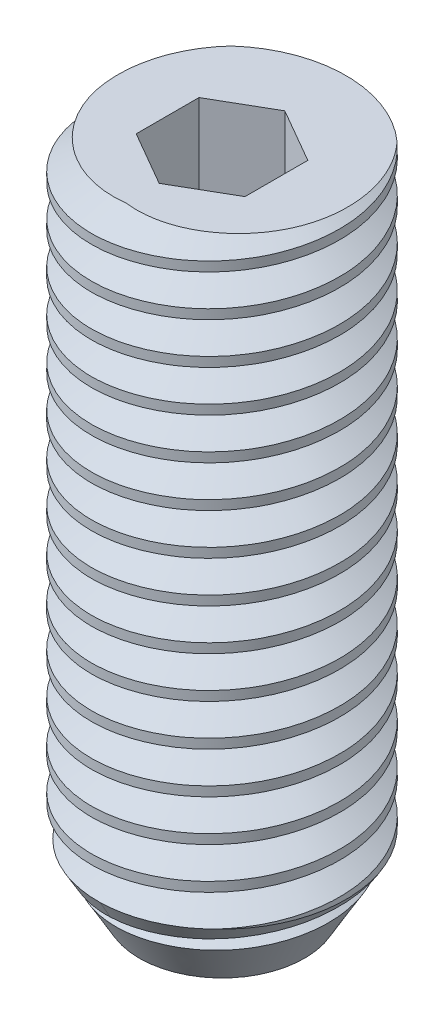
from build123d import *

# Parameters (mm, degrees)
SKETCH1_R           = 1.5
BOSS_EXTRUDE1_DEPTH = 8
CUT_EXTRUDE1_DEPTH  = 1.2
CHAMFER1_SIZE       = 0.5
CHAMFER1_SIZE2      = 0.866025404
CUT_SWEEP13_PITCH   = 0.5


with BuildPart() as part:
    # Sketch1 → Boss-Extrude1 (new body)
    with BuildSketch(Plane(origin=(0, 0, 0), x_dir=(1, 0, 0), z_dir=(0, 1, 0))):
        with Locations(Location((0, 0, 0), (0, 0, 270))):
            Circle(SKETCH1_R)
    extrude(amount=BOSS_EXTRUDE1_DEPTH)

    # Sketch2 → Cut-Extrude1 (cut)
    with BuildSketch(Plane(origin=(0, 8, 0), x_dir=(1, 0, 0), z_dir=(0, 1, 0))):
        Polygon((0, 0.76), (-0.658179307, 0.38), (-0.658179307, -0.38), (0, -0.76), (0.658179307, -0.38), (0.658179307, 0.38), align=None)
    extrude(amount=-CUT_EXTRUDE1_DEPTH, mode=Mode.SUBTRACT)

    # Chamfer1
    chamfer1_edges = [part.edges().sort_by_distance(p)[0] for p in [
        (0, 0, -1.5),
    ]]
    chamfer1_side = [part.faces().sort_by_distance(p)[0] for p in [
        (0, 0, 0),
    ]]
    chamfer(chamfer1_edges, length=CHAMFER1_SIZE, length2=CHAMFER1_SIZE2, reference=chamfer1_side[0])

    # Cut-Sweep13: arcs per turn and ends read off the stored shape
    # Cut-Sweep13: the profile of Sketch15 screwed along a right-hand helix through 17 turns, 6 arcs to a turn; built about Z, then put on its axis
    cut_sweep13_z = Axis((0, 0, 0), (0, 0, 1))
    cut_sweep13_corners = [(1.166666667, 2.04e-07, -0.374999986), (1.666666667, 2.91e-07, -0.663675121), (1.666666667, 2.91e-07, -0.086324852)]
    with BuildLine(mode=Mode.PRIVATE) as cut_sweep13_profile:
        Line(cut_sweep13_corners[0], cut_sweep13_corners[1])
        Line(cut_sweep13_corners[1], cut_sweep13_corners[2])
        Line(cut_sweep13_corners[2], cut_sweep13_corners[0])
    cut_sweep13_cap = Face(cut_sweep13_profile.wire())
    cut_sweep13_turn_angles = [0, 30, 60, 90, 120, 150, 180, 210, 240, 270, 300, 330, 360]
    cut_sweep13_turn_weights = [1, 0.8660254037844387, 1, 0.8660254037844387, 1, 0.8660254037844387, 1, 0.8660254037844387, 1, 0.8660254037844387, 1, 0.8660254037844387, 1]
    cut_sweep13_turn_rails = [Edge.make_bspline([Vector(p[0], p[1], 0).rotate(cut_sweep13_z, cut_sweep13_turn_angles[k]) / cut_sweep13_turn_weights[k] + Vector(0, 0, p[2] + CUT_SWEEP13_PITCH * cut_sweep13_turn_angles[k] / 360) for k in range(13)], [0, 0, 0, 1, 1, 2, 2, 3, 3, 4, 4, 5, 5, 6, 6, 6], 2, cut_sweep13_turn_weights) for p in cut_sweep13_corners]
    cut_sweep13_turn_sides = [Face.make_surface_from_curves(cut_sweep13_turn_rails[p[0]], cut_sweep13_turn_rails[p[1]]) for p in [(0, 1), (1, 2), (2, 0)]]
    cut_sweep13 = Plane(origin=(0, 8, 0), x_dir=(-1, 0, 0), z_dir=(0, -1, 0)) * Solid(Shell([*[p.moved(Location((0, 0, CUT_SWEEP13_PITCH * i))) for i in range(17) for p in cut_sweep13_turn_sides], cut_sweep13_cap, cut_sweep13_cap.rotate(cut_sweep13_z, 6120).moved(Location((0, 0, CUT_SWEEP13_PITCH * 6120 / 360)))]))
    add(cut_sweep13, mode=Mode.SUBTRACT)


solid = part.part
